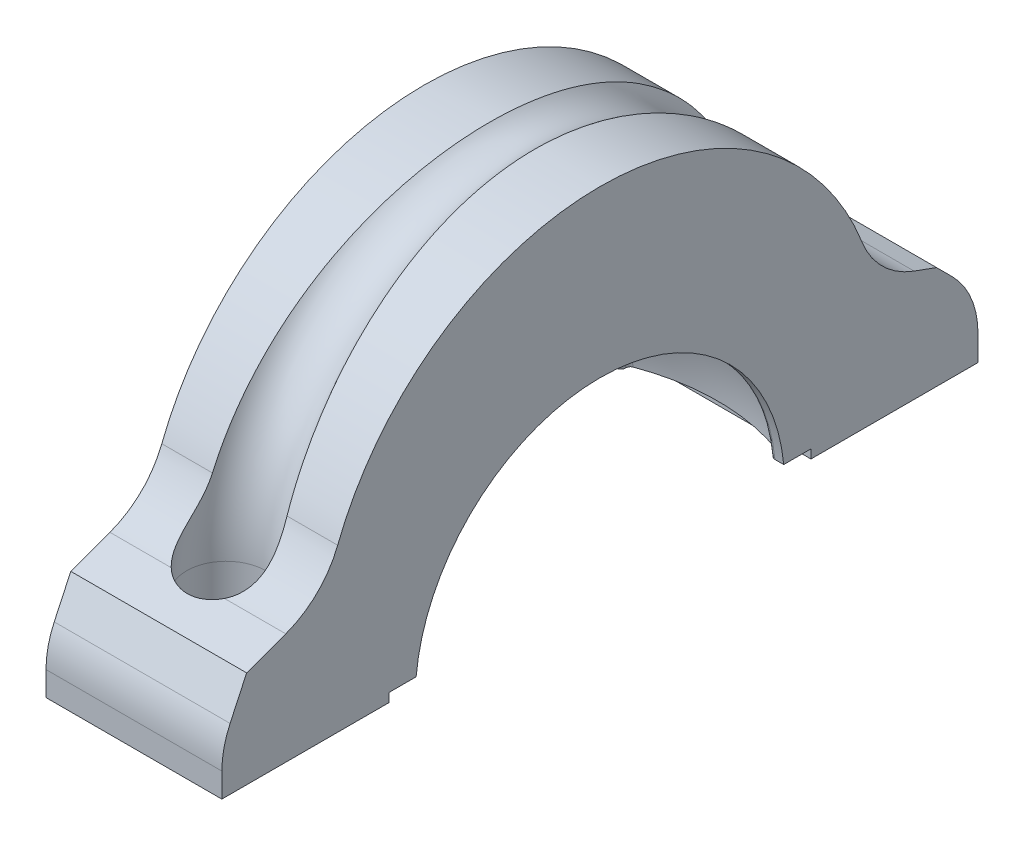
from build123d import *
from OCP.BRepFilletAPI import BRepFilletAPI_MakeChamfer

# Parameters (mm, degrees)
BOSS_EXTRUDE1_DEPTH = 20
FILLET1_R           = 10
CHAMFER1_SIZE       = 3
CHAMFER1_SIZE2      = 5.019471555
SKETCH5_R           = 4.5
FILLET4_R           = 10
FILLET5_R           = 0.5


with BuildPart() as part:
    # Sketch1 → Boss-Extrude1 (new body)
    with BuildSketch(Plane(origin=(0, 0, 0), x_dir=(0, 0, -1), z_dir=(1, 0, 0))):
        with BuildLine():
            Line((-86, 0), (-67, 0))
            Line((-67, 0), (-67, 1))
            Line((-67, 1), (-19, 1))
            Line((-19, 1), (-19, 0))
            Line((-19, 0), (0, 0))
            Line((0, 0), (0, 10))
            Line((0, 10), (-11.889492676, 14.327421434))
            ThreePointArc((-11.889492676, 14.327421434), (-43, 38.835002999), (-74.110507324, 14.327421434))
            Line((-74.110507324, 14.327421434), (-86, 10))
            Line((-86, 10), (-86, 0))
        make_face()
    extrude(amount=BOSS_EXTRUDE1_DEPTH)

    # Fillet1
    fillet1_edges = [part.edges().sort_by_distance(p)[0] for p in [
        (10, 14.327421434, 11.889492676),
        (10, 14.327421434, 74.110507324),
    ]]
    fillet(fillet1_edges, radius=FILLET1_R)

    # Chamfer1: one chamfer whose edges measure the first distance from different faces: ONE call of the kernel's chamfer builder (chamfer() names one face for all edges)
    chamfer1_edges_1 = [part.edges().sort_by_distance(p)[0] for p in [
        (10, 10, 0),
    ]]
    chamfer1_side_1 = [part.faces().sort_by_distance(p)[0] for p in [
        (10, 5, 0),
    ]]
    chamfer1_edges_2 = [part.edges().sort_by_distance(p)[0] for p in [
        (10, 10, 86),
    ]]
    chamfer1_side_2 = [part.faces().sort_by_distance(p)[0] for p in [
        (10, 11.323089013, 82.364842814),
    ]]
    chamfer1 = BRepFilletAPI_MakeChamfer(part.part.solid().wrapped)
    for e in chamfer1_edges_1:
        chamfer1.Add(CHAMFER1_SIZE, CHAMFER1_SIZE2, e.wrapped, chamfer1_side_1[0].wrapped)  # the first distance lies on this face
    for e in chamfer1_edges_2:
        chamfer1.Add(CHAMFER1_SIZE, CHAMFER1_SIZE2, e.wrapped, chamfer1_side_2[0].wrapped)  # the first distance lies on this face
    add(Compound.cast(chamfer1.Shape()), mode=Mode.REPLACE)

    # augu cut: sweep along a path in Sketch2
    with BuildLine(Plane(origin=(10, 0, 0), x_dir=(0, 0, -1), z_dir=(1, 0, 0))) as augu_cut_path:
        Line((-10.5, -11.403017839), (-10.5, 10))
        ThreePointArc((-10.5, 10), (-43, 42.5), (-75.5, 10))
        Line((-75.5, 10), (-75.5, -11.403017839))
    # Sketch5 → augu cut (sweep, cut)
    with BuildSketch(Plane(origin=(0, -11.403017839, 0), x_dir=(-1, 0, 0), z_dir=(0, -1, 0))):
        with Locations((-10, -10.5)):
            Circle(SKETCH5_R)
    sweep(path=augu_cut_path.line, mode=Mode.SUBTRACT)

    # Sketch6 → Cut-Revolve2 (revolve, cut)
    with BuildSketch(Plane.XZ.offset(1)):
        with BuildLine():
            Line((0, 64), (1.5, 64))
            Line((1.5, 64), (1.5, 64.9089023))
            ThreePointArc((1.5, 64.9089023), (10, 66.5), (18.5, 64.9089023))
            Line((18.5, 64.9089023), (18.5, 64))
            Line((18.5, 64), (20, 64))
            Line((20, 64), (20, 43))
            Line((20, 43), (0, 43))
            Line((0, 43), (0, 64))
        make_face()
    revolve(axis=Axis((0, -1, 43), (1, 0, 0)), mode=Mode.SUBTRACT)

    # Fillet4
    fillet4_edges = [part.edges().sort_by_distance(p)[0] for p in [
        (10, 4.980528445, 86),
        (10, 7, 0),
    ]]
    fillet(fillet4_edges, radius=FILLET4_R)

    # Fillet5
    fillet5_edges = [part.edges().sort_by_distance(p)[0] for p in [
        (1.5, 20.9089023, 43),
        (1.5, 20, 43),
        (18.5, 20, 43),
        (18.5, 20.9089023, 43),
    ]]
    fillet(fillet5_edges, radius=FILLET5_R)


solid = part.part
